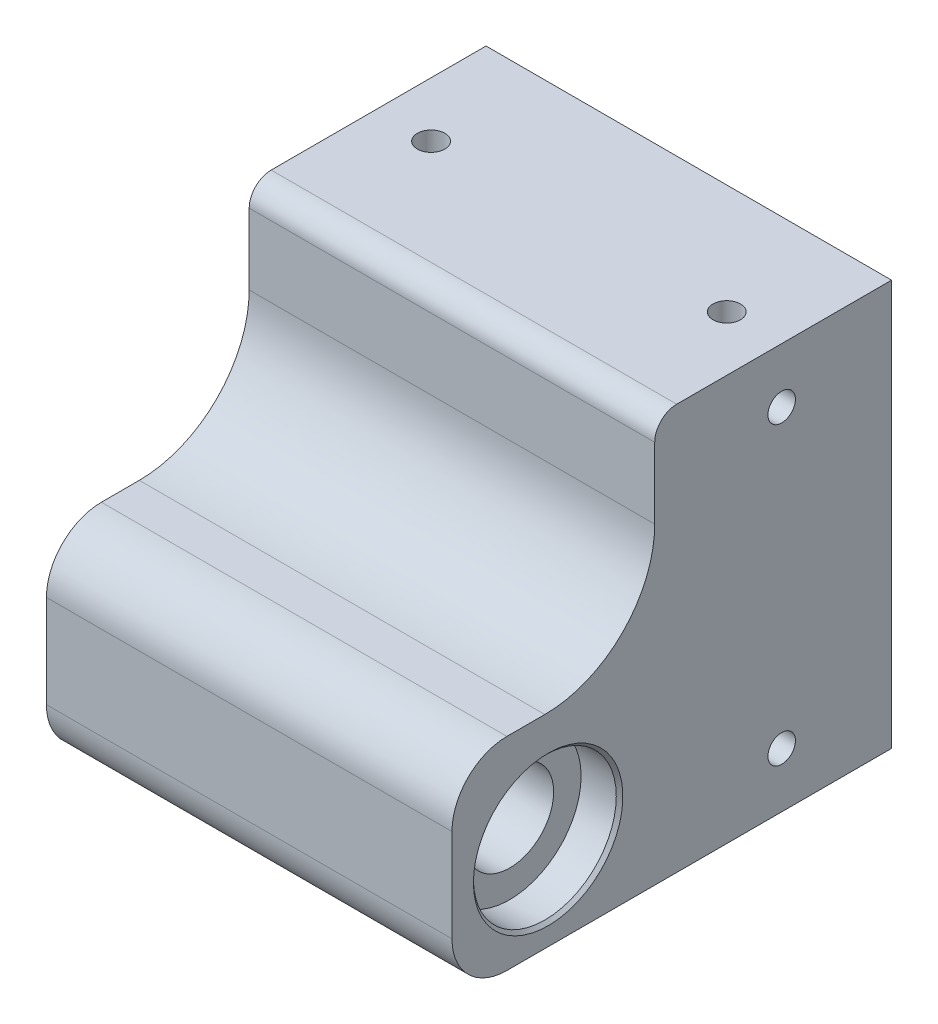
from build123d import *

# Parameters (mm, degrees)
SKETCH_1_W             = 36.9
SKETCH_1_H             = 36.9
EXTRUDE_1_DEPTH        = 20
SKETCH_2_R             = 4
CUT_EXTRUDE_1_DEPTH    = 36.9
SKETCH_3_R             = 6.5
CUT_EXTRUDE_2_DEPTH    = 3.5
CUT_EXTRUDE_3_DEPTH    = 51
FILLET_1_R             = 10
FILLET_2_R             = 5
SKETCH_5_W             = 16.9
SKETCH_5_H             = 16.9
SKETCH_5_W_2           = 7
SKETCH_5_H_2           = 7
CUT_EXTRUDE_4_DEPTH    = 16.55
HOLE_WIZARD_M3_1_D     = 2.5
HOLE_WIZARD_M3_1_DEPTH = 10
HOLE_WIZARD_M3_2_D     = 2.5
HOLE_WIZARD_M3_3_D     = 2.5
HOLE_WIZARD_M3_3_DEPTH = 10
FILLET_3_R             = 2
FILLET_7_R             = 2
CHAMFER_1_SIZE         = 0.3


with BuildPart() as part:
    # 草图1 → 凸台-拉伸1 (new, symmetric)
    with BuildSketch(Plane.XY):
        Rectangle(SKETCH_1_W, SKETCH_1_H)
    extrude(amount=EXTRUDE_1_DEPTH, both=True)

    # 草图2 → 切除-拉伸1 (cut)
    with BuildSketch(Plane(origin=(18.45, 0, 0), x_dir=(0, 0, -1), z_dir=(1, 0, 0))):
        with Locations((-11.25, -10)):
            Circle(SKETCH_2_R)
        Polygon((-1.5, 18.5), (-20, 0), (-20, 18.5), align=None)
    extrude(amount=-CUT_EXTRUDE_1_DEPTH, mode=Mode.SUBTRACT)

    # 草图3 → 切除-拉伸2 (cut)
    with BuildSketch(Plane(origin=(18.45, 0, 0), x_dir=(0, 0, -1), z_dir=(1, 0, 0))):
        with Locations((-11.25, -10)):
            Circle(SKETCH_3_R)
    cut_extrude_2 = extrude(amount=-CUT_EXTRUDE_2_DEPTH, mode=Mode.SUBTRACT)

    # 镜向1: 切除-拉伸2 across plane
    add(cut_extrude_2.mirror(Plane(origin=(0, 0, 0), x_dir=(0, 0, 1), z_dir=(1, 0, 0))), mode=Mode.SUBTRACT)

    # 草图4 → 切除-拉伸3 (cut)
    with BuildSketch(Plane(origin=(18.45, 0, 0), x_dir=(0, 0, -1), z_dir=(1, 0, 0))):
        Polygon((-20, 0), (-1.55, 0), (-1.55, 18.45), align=None)
    extrude(amount=-CUT_EXTRUDE_3_DEPTH, mode=Mode.SUBTRACT)

    # 圆角1
    fillet_1_edges = [part.edges().sort_by_distance(p)[0] for p in [
        (0, 0, 1.55),
    ]]
    fillet(fillet_1_edges, radius=FILLET_1_R)

    # 圆角2
    fillet_2_edges = [part.edges().sort_by_distance(p)[0] for p in [
        (0, -18.45, 20),
        (0, 0, 20),
    ]]
    fillet(fillet_2_edges, radius=FILLET_2_R)

    # 草图5 → 切除-拉伸4 (cut)
    with BuildSketch(Plane(origin=(0, 0, -20), x_dir=(-1, 0, 0), z_dir=(0, 0, -1))):
        Rectangle(SKETCH_5_W, SKETCH_5_H)
        with Locations((-11.95, 0)):
            Rectangle(SKETCH_5_W_2, SKETCH_5_H)
        with Locations((0, 11.95)):
            Rectangle(SKETCH_5_W, SKETCH_5_H_2)
        with Locations((11.95, 0)):
            Rectangle(SKETCH_5_W_2, SKETCH_5_H)
        with Locations((0, -11.95)):
            Rectangle(SKETCH_5_W, SKETCH_5_H_2)
    extrude(amount=-CUT_EXTRUDE_4_DEPTH, mode=Mode.SUBTRACT)

    # M3 螺纹孔1
    with Locations(Plane(origin=(0, 18.45, 0), x_dir=(1, 0, 0), z_dir=(0, 1, 0))):
        with Locations((-13.45, 10), (13.45, 10)):
            Hole(HOLE_WIZARD_M3_1_D / 2, depth=HOLE_WIZARD_M3_1_DEPTH)

    # M3 螺纹孔2 (through all)
    with Locations(Plane(origin=(18.45, 0, 0), x_dir=(0, 0, -1), z_dir=(1, 0, 0))):
        with Locations((10, -13.45)):
            hole_wizard_m3_2 = Hole(HOLE_WIZARD_M3_2_D / 2)

    # 镜向2: M3 螺纹孔2 across plane
    add(hole_wizard_m3_2.mirror(Plane(origin=(0, 0, 0), x_dir=(0, 0, 1), z_dir=(1, 0, 0))), mode=Mode.SUBTRACT)

    # M3 螺纹孔3
    with Locations(Plane(origin=(0, -18.45, 0), x_dir=(-1, 0, 0), z_dir=(0, -1, 0))):
        with Locations((10, 5), (-10, 5)):
            Hole(HOLE_WIZARD_M3_3_D / 2, depth=HOLE_WIZARD_M3_3_DEPTH)

    # 圆角3
    # the kernel refuses this fillet: 2 mm, written as the material it adds along each edge
    with BuildSketch(Plane(origin=(-15.45, 8.45, -20), x_dir=(1, 0, 0), z_dir=(0, 0, 1))) as fillet_3_piece_1_section:
        with BuildLine():
            CenterArc((FILLET_3_R, -FILLET_3_R), FILLET_3_R, 90, 90)
            Line((0, -FILLET_3_R), (0, 0))
            Line((0, 0), (FILLET_3_R, 0))
        make_face()
    fillet_3_piece_1 = extrude(amount=21.55, mode=Mode.PRIVATE)
    fillet_3_piece_1 = fillet_3_piece_1 - Plane(origin=(-13.45, 7.989094357, -10), x_dir=(-1, 0, 0), z_dir=(0, -1, 0)) * Cylinder(1.25, 52, mode=Mode.PRIVATE)
    add(fillet_3_piece_1)
    with BuildSketch(Plane(origin=(-15.45, -8.45, -20), x_dir=(0, 1, 0), z_dir=(0, 0, 1)), Plane(origin=(15.45, -8.45, -20), x_dir=(-1, 0, 0), z_dir=(0, 0, 1)), Plane(origin=(8.45, 15.45, -20), x_dir=(0, -1, 0), z_dir=(0, 0, 1)), Plane(origin=(-8.45, 15.45, -20), x_dir=(1, 0, 0), z_dir=(0, 0, 1))) as fillet_3_piece_2:
        with BuildLine():
            CenterArc((FILLET_3_R, -FILLET_3_R), FILLET_3_R, 90, 90)
            Line((0, -FILLET_3_R), (0, 0))
            Line((0, 0), (FILLET_3_R, 0))
        make_face()
    extrude(amount=21.55)
    with BuildSketch(Plane(origin=(-8.45, -15.45, -20), x_dir=(0, 1, 0), z_dir=(0, 0, 1))) as fillet_3_piece_3_section:
        with BuildLine():
            CenterArc((FILLET_3_R, -FILLET_3_R), FILLET_3_R, 90, 90)
            Line((0, -FILLET_3_R), (0, 0))
            Line((0, 0), (FILLET_3_R, 0))
        make_face()
    fillet_3_piece_3 = extrude(amount=21.55, mode=Mode.PRIVATE)
    fillet_3_piece_3 = fillet_3_piece_3 - Plane(origin=(-7.989094431, -13.45, -10), x_dir=(0, 0, 1), z_dir=(-1, 0, 0)) * Cylinder(1.25, 52, mode=Mode.PRIVATE)
    add(fillet_3_piece_3)
    with BuildSketch(Plane(origin=(8.45, -15.45, -20), x_dir=(-1, 0, 0), z_dir=(0, 0, 1))) as fillet_3_piece_4_section:
        with BuildLine():
            CenterArc((FILLET_3_R, -FILLET_3_R), FILLET_3_R, 90, 90)
            Line((0, -FILLET_3_R), (0, 0))
            Line((0, 0), (FILLET_3_R, 0))
        make_face()
    fillet_3_piece_4 = extrude(amount=21.55, mode=Mode.PRIVATE)
    fillet_3_piece_4 = fillet_3_piece_4 - Plane(origin=(7.989094875, -13.45, -10), x_dir=(0, 0, 1), z_dir=(-1, 0, 0)) * Cylinder(1.25, 52, mode=Mode.PRIVATE)
    add(fillet_3_piece_4)
    with BuildSketch(Plane(origin=(15.45, 8.45, -20), x_dir=(-1, 0, 0), z_dir=(0, 0, 1))) as fillet_3_piece_5_section:
        with BuildLine():
            CenterArc((FILLET_3_R, FILLET_3_R), FILLET_3_R, 180, 90)
            Line((0, FILLET_3_R), (0, 0))
            Line((0, 0), (FILLET_3_R, 0))
        make_face()
    fillet_3_piece_5 = extrude(amount=21.55, mode=Mode.PRIVATE)
    fillet_3_piece_5 = fillet_3_piece_5 - Plane(origin=(13.45, 7.989094431, -10), x_dir=(-1, 0, 0), z_dir=(0, -1, 0)) * Cylinder(1.25, 52, mode=Mode.PRIVATE)
    add(fillet_3_piece_5)
    # the kernel refuses this fillet: 2 mm, written as the material it takes off along each edge
    with BuildSketch(Plane(origin=(-8.45, 8.45, -25), x_dir=(-1, 0, 0), z_dir=(0, 0, 1)), Plane(origin=(8.45, -8.45, -25), x_dir=(1, 0, 0), z_dir=(0, 0, 1))) as fillet_3_2_piece_1:
        with BuildLine():
            CenterArc((FILLET_3_R, -FILLET_3_R), FILLET_3_R, 90, 90)
            Line((0, -FILLET_3_R), (0, 0))
            Line((0, 0), (FILLET_3_R, 0))
        make_face()
    extrude(amount=21.55, mode=Mode.SUBTRACT)
    with BuildSketch(Plane(origin=(-8.45, -8.45, -25), x_dir=(-1, 0, 0), z_dir=(0, 0, 1)), Plane(origin=(8.45, 8.45, -25), x_dir=(1, 0, 0), z_dir=(0, 0, 1))) as fillet_3_2_piece_2:
        with BuildLine():
            CenterArc((FILLET_3_R, FILLET_3_R), FILLET_3_R, 180, 90)
            Line((0, FILLET_3_R), (0, 0))
            Line((0, 0), (FILLET_3_R, 0))
        make_face()
    extrude(amount=21.55, mode=Mode.SUBTRACT)

    # 圆角7
    fillet_7_edges = [part.edges().sort_by_distance(p)[0] for p in [
        (0, 18.45, 1.55),
    ]]
    fillet(fillet_7_edges, radius=FILLET_7_R)

    # 镜向3: M3 螺纹孔2 across plane
    add(hole_wizard_m3_2.mirror(Plane.ZX), mode=Mode.SUBTRACT)

    # 倒角1
    chamfer_1_edges = [part.edges().sort_by_distance(p)[0] for p in [
        (18.45, -10, 17.75),
        (-18.45, -10, 17.75),
    ]]
    chamfer(chamfer_1_edges, length=CHAMFER_1_SIZE)


solid = part.part
